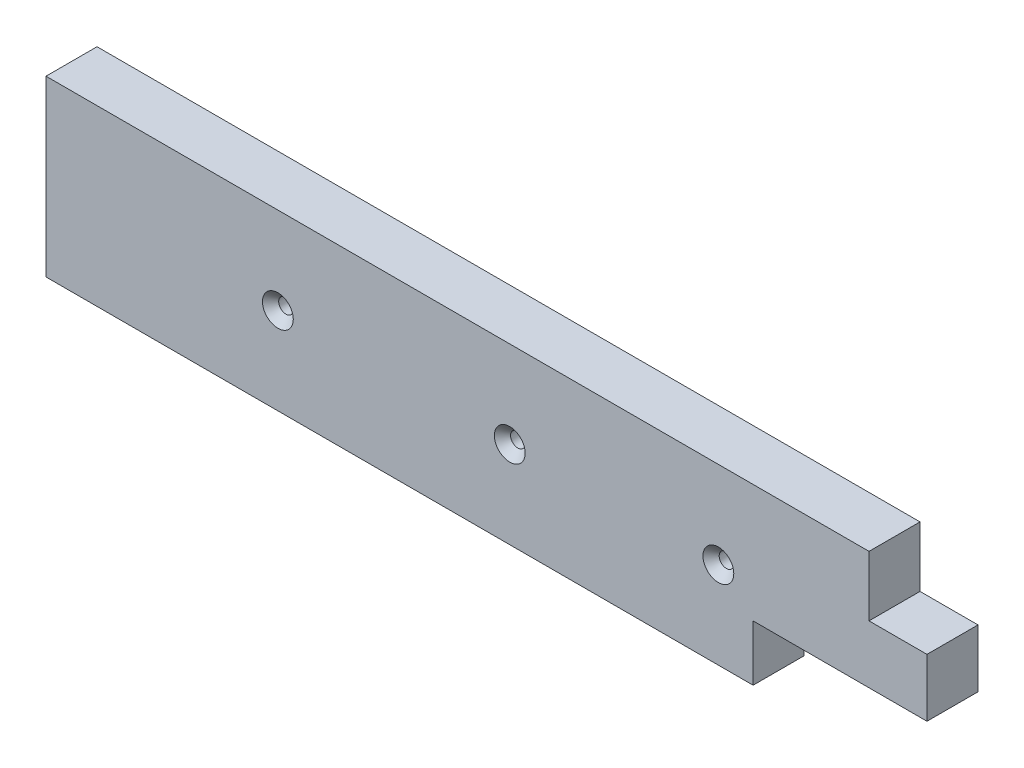
from build123d import *

# Parameters (mm, degrees)
SKETCH1_W                                            = 386.012712352
SKETCH1_H                                            = 22.352
BOSS_EXTRUDE1_DEPTH                                  = 38.1
CSK_FOR_M6_HEX_SOCKET_COUNTERSUNK_HEAD_S_D           = 6.4
CSK_FOR_M6_HEX_SOCKET_COUNTERSUNK_HEAD_S_CSINK_D     = 13.5
CSK_FOR_M6_HEX_SOCKET_COUNTERSUNK_HEAD_S_CSINK_ANGLE = 90
CSK_FOR_M6_HEX_SOCKET_COUNTERSUNK_HE_2_D             = 6.4
CSK_FOR_M6_HEX_SOCKET_COUNTERSUNK_HE_2_CSINK_D       = 13.5
CSK_FOR_M6_HEX_SOCKET_COUNTERSUNK_HE_2_CSINK_ANGLE   = 90
CSK_FOR_M6_HEX_SOCKET_COUNTERSUNK_HE_3_D             = 6.4
CSK_FOR_M6_HEX_SOCKET_COUNTERSUNK_HE_3_CSINK_D       = 13.5
CSK_FOR_M6_HEX_SOCKET_COUNTERSUNK_HE_3_CSINK_ANGLE   = 90
SKETCH3_W                                            = 25.4
SKETCH3_H                                            = 26.385363165
SKETCH3_W_2                                          = 76.186487456
SKETCH3_H_2                                          = 24.414636835
CUT_EXTRUDE1_DEPTH                                   = 198.996655094


with BuildPart() as part:
    # Sketch1 → Boss-Extrude1 (new, symmetric)
    with BuildSketch(Plane(origin=(0, 0, 0), x_dir=(1, 0, 0), z_dir=(0, 1, 0))):
        Rectangle(SKETCH1_W, SKETCH1_H)
    extrude(amount=BOSS_EXTRUDE1_DEPTH, both=True)

    # CSK for M6 Hex Socket Countersunk Head S (through all)
    with Locations(Plane.XY.offset(11.176)):
        with Locations((-91.406356176, 0)):
            CounterSinkHole(CSK_FOR_M6_HEX_SOCKET_COUNTERSUNK_HEAD_S_D / 2, CSK_FOR_M6_HEX_SOCKET_COUNTERSUNK_HEAD_S_CSINK_D / 2, counter_sink_angle=CSK_FOR_M6_HEX_SOCKET_COUNTERSUNK_HEAD_S_CSINK_ANGLE)

    # CSK for M6 Hex Socket Countersunk He 2 (through all)
    with Locations(Plane.XY.offset(11.176)):
        with Locations((10.193643824, 0)):
            CounterSinkHole(CSK_FOR_M6_HEX_SOCKET_COUNTERSUNK_HE_2_D / 2, CSK_FOR_M6_HEX_SOCKET_COUNTERSUNK_HE_2_CSINK_D / 2, counter_sink_angle=CSK_FOR_M6_HEX_SOCKET_COUNTERSUNK_HE_2_CSINK_ANGLE)

    # CSK for M6 Hex Socket Countersunk He 3 (through all)
    with Locations(Plane.XY.offset(11.176)):
        with Locations((101.6, 0)):
            CounterSinkHole(CSK_FOR_M6_HEX_SOCKET_COUNTERSUNK_HE_3_D / 2, CSK_FOR_M6_HEX_SOCKET_COUNTERSUNK_HE_3_CSINK_D / 2, counter_sink_angle=CSK_FOR_M6_HEX_SOCKET_COUNTERSUNK_HE_3_CSINK_ANGLE)

    # Sketch3 → Cut-Extrude1 (cut, through all)
    with BuildSketch(Plane.XY.offset(11.176)):
        with Locations((180.306356176, 24.907318418)):
            Rectangle(SKETCH3_W, SKETCH3_H)
        with Locations((154.913112448, -25.892681582)):
            Rectangle(SKETCH3_W_2, SKETCH3_H_2)
    extrude(amount=-CUT_EXTRUDE1_DEPTH, mode=Mode.SUBTRACT)


solid = part.part
